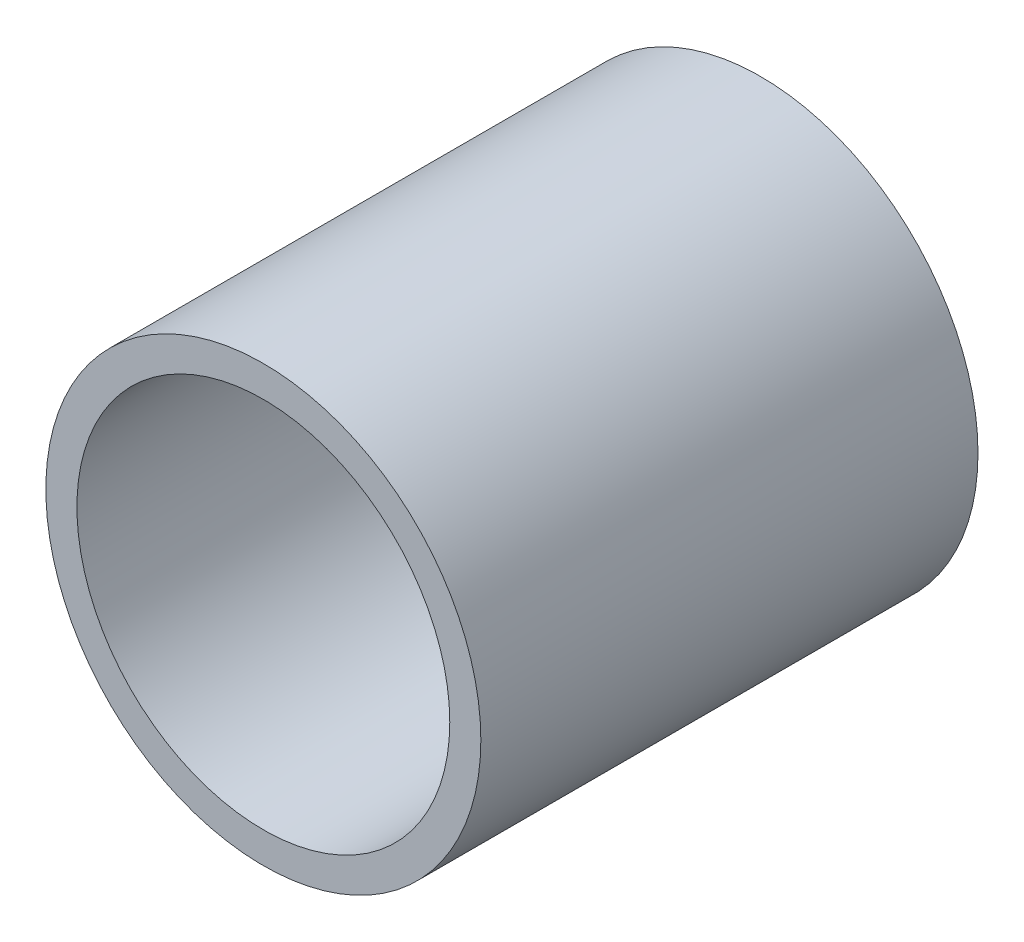
from build123d import *

# Parameters (mm, degrees)
SKETCH1_R           = 22.225
SKETCH1_R_2         = 19.05
BOSS_EXTRUDE1_DEPTH = 50.8


with BuildPart() as part:
    # Sketch1 → Boss-Extrude1 (new body)
    with BuildSketch(Plane.XY):
        Circle(SKETCH1_R)
        Circle(SKETCH1_R_2, mode=Mode.SUBTRACT)
    extrude(amount=-BOSS_EXTRUDE1_DEPTH)


solid = part.part
